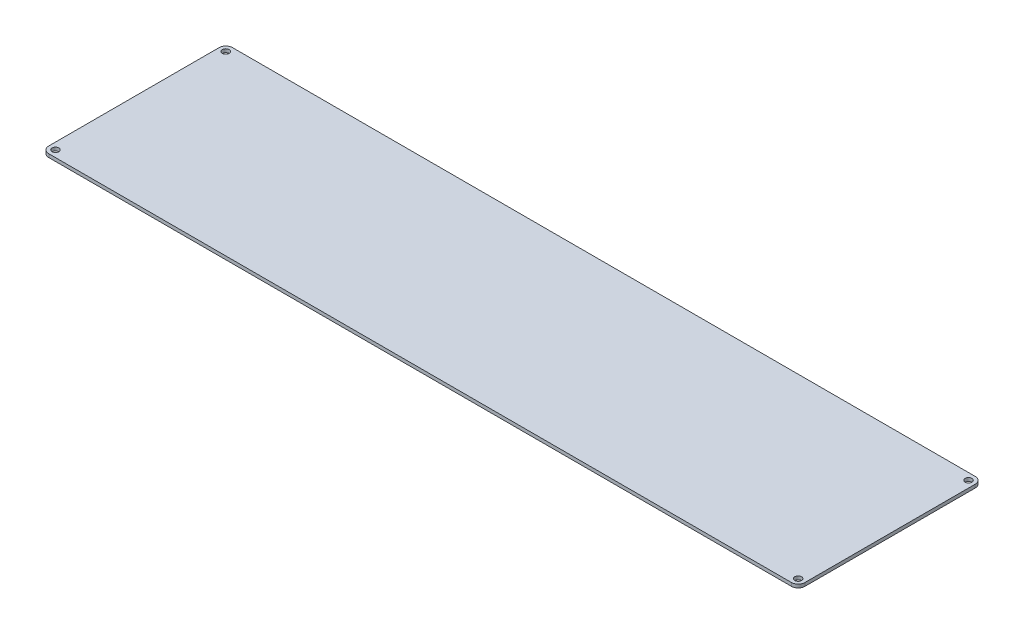
from build123d import *

# Parameters (mm, degrees)
SKETCH1_W           = 713.791017653
SKETCH1_H           = 173.482
SKETCH1_R           = 3.175
BOSS_EXTRUDE1_DEPTH = 3.175
FILLET1_R           = 6.35


with BuildPart() as part:
    # Sketch1 → Boss-Extrude1 (new body)
    with BuildSketch(Plane(origin=(0, 0, 0), x_dir=(1, 0, 0), z_dir=(0, 1, 0))):
        with Locations((-22.944046964, 112.256050824)):
            Rectangle(SKETCH1_W, SKETCH1_H)
        with Locations((-373.489555791, 31.865050824)):
            Circle(SKETCH1_R, mode=Mode.SUBTRACT)
        with Locations((327.601461862, 31.865050824)):
            Circle(SKETCH1_R, mode=Mode.SUBTRACT)
        with Locations((-373.489555791, 192.647050824)):
            Circle(SKETCH1_R, mode=Mode.SUBTRACT)
        with Locations((327.601461862, 192.647050824)):
            Circle(SKETCH1_R, mode=Mode.SUBTRACT)
    extrude(amount=-BOSS_EXTRUDE1_DEPTH)

    # Fillet1
    fillet1_edges = [part.edges().sort_by_distance(p)[0] for p in [
        (-379.839555791, -1.5875, -198.997050824),
        (-379.839555791, -1.5875, -25.515050824),
        (333.951461862, -1.5875, -25.515050824),
        (333.951461862, -1.5875, -198.997050824),
    ]]
    fillet(fillet1_edges, radius=FILLET1_R)


solid = part.part
